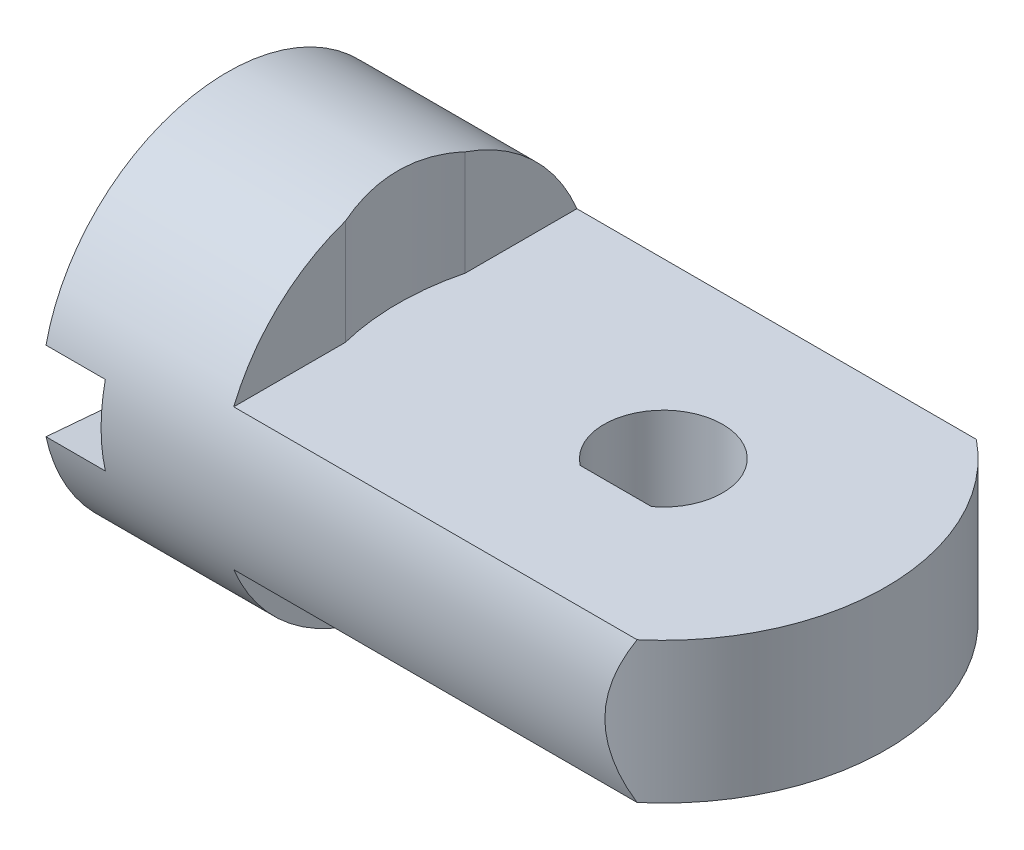
from build123d import *

# Parameters (mm, degrees)
SKETCH_1_W                = 50
SKETCH_1_H                = 40
EXTRUDE_1_DEPTH           = 8
CHAMFER_1_SIZE            = 10
SKETCH_2_R                = 1.55
CUT_EXTRUDE_1_DEPTH       = 10
EXTRUDE_2_DEPTH           = 50
EXTRUDE_2_DEPTH_BACK      = 15
SKETCH_3_R                = 12.5
SKETCH_4_R                = 1.7
CUT_EXTRUDE_2_DEPTH       = 15
CUT_EXTRUDE_START         = -20
CUT_EXTRUDE_3_DEPTH       = 20
SKETCH_7_R                = 16.5
CUT_EXTRUDE_8_DEPTH       = 33
CUT_EXTRUDE_9_DEPTH       = 20
CHAMFER_3_SIZE            = 2
SKETCH_10_OUTSIDE_W       = 49.114
SKETCH_10_OUTSIDE_H       = 64.114
SKETCH_10_OUTSIDE_R       = 12.5
CUT_EXTRUDE_10_DEPTH      = 10
CHAMFER_4_SIZE            = 10
SKETCH_12_W               = 1.5
SKETCH_12_H               = 20
SKETCH_14_W               = 12
SKETCH_14_H               = 23
CUT_EXTRUDE_11_DEPTH      = 3
CUT_EXTRUDE_12_DEPTH      = 4.2
SKETCH_16_R               = 1.1
CUT_EXTRUDE_13_DEPTH      = 5
SKETCH_17_R               = 3.372674955
EXTRUDE_3_DEPTH           = 4
SKETCH_18_R               = 1.1
CUT_EXTRUDE_14_DEPTH      = 4
SKETCH_20_R               = 4
CUT_EXTRUDE_15_DEPTH      = 4
CUT_EXTRUDE_16_DEPTH      = 80.355214185
CUT_EXTRUDE_16_DEPTH_BACK = 80.355214185
SKETCH_21_W               = 47.755098741
SKETCH_21_H               = 76.122443719
SKETCH_26_R               = 4
CUT_EXTRUDE_19_DEPTH      = 20
SKETCH_28_W               = 34.99561618
SKETCH_28_H               = 41.128829021
CUT_EXTRUDE_20_DEPTH      = 10
SKETCH_29_W               = 7.599941767
SKETCH_29_H               = 6.479768366
EXTRUDE_6_DEPTH           = 9.5
SKETCH_24_R               = 12.607397707
CUT_EXTRUDE_21_DEPTH      = 15
CUT_EXTRUDE_22_DEPTH      = 4


# Read off the part's stored shape, not the designer's step: 切除-拉伸3
with BuildPart() as part:
    # 草图1 → 凸台-拉伸1 (new body)
    with BuildSketch(Plane.XY):
        Rectangle(SKETCH_1_W, SKETCH_1_H)
    extrude(amount=EXTRUDE_1_DEPTH)

    # 倒角1
    chamfer_1_edges = [part.edges().sort_by_distance(p)[0] for p in [
        (-25, -20, 4),
        (-25, 20, 4),
    ]]
    chamfer(chamfer_1_edges, length=CHAMFER_1_SIZE)

    # 草图2 → 切除-拉伸1 (cut)
    with BuildSketch(Plane.XY.offset(8)):
        with Locations((-2, -10)):
            Circle(SKETCH_2_R)
        with Locations((-2, 10)):
            Circle(SKETCH_2_R)
    extrude(amount=-CUT_EXTRUDE_1_DEPTH, mode=Mode.SUBTRACT)

    # 草图3 → 凸台-拉伸2 (add, two sides: drawn at the far end of the back side and taken through both)
    with BuildSketch(Plane(origin=(25, 0, 0), x_dir=(0, 0, -1), z_dir=(1, 0, 0)).offset(-EXTRUDE_2_DEPTH_BACK)):
        with Locations(Location((-4, 0, 0), (0, 0, 251.337075115))):
            Circle(SKETCH_3_R)
    extrude(amount=EXTRUDE_2_DEPTH + EXTRUDE_2_DEPTH_BACK)

    # 草图4 → 切除-拉伸2 (cut)
    with BuildSketch(Plane.XY.offset(8)):
        with Locations((-19.690178066, -4)):
            Circle(SKETCH_4_R)
        with Locations((-19.690178066, 4)):
            Circle(SKETCH_4_R)
    extrude(amount=-CUT_EXTRUDE_2_DEPTH, mode=Mode.SUBTRACT)

    # 切除-拉伸3 outline → 切除-拉伸3 (cut)
    with BuildSketch(Plane(origin=(75, 0, 0), x_dir=(0, 0, -1), z_dir=(1, 0, 0)).offset(CUT_EXTRUDE_START)):
        with BuildLine():
            Line((7.56233108, -4.75), (-15.56233108, -4.75))
            ThreePointArc((-15.56233108, -4.75), (-4, -12.5), (7.56233108, -4.75))
        make_face()
        with BuildLine():
            ThreePointArc((7.56233108, 4.75), (-4, 12.5), (-15.56233108, 4.75))
            Line((-15.56233108, 4.75), (7.56233108, 4.75))
        make_face()
    extrude(amount=CUT_EXTRUDE_3_DEPTH, mode=Mode.SUBTRACT)

    # 草图7 → 切除-拉伸8 (cut)
    with BuildSketch(Plane.XZ.offset(4.75)):
        with Locations((58.5, 4)):
            Circle(SKETCH_7_R)
    cut_extrude_8 = extrude(amount=CUT_EXTRUDE_8_DEPTH, mode=Mode.SUBTRACT)

    # 镜向1: 切除-拉伸8 across plane
    add(cut_extrude_8.mirror(Plane.ZX), mode=Mode.SUBTRACT)

    # 草图8 → 切除-拉伸9 (cut)
    with BuildSketch(Plane.XZ.offset(4.75)):
        with BuildLine():
            Line((60, 19.107397707), (75.764252489, 33.62580965))
            Line((75.764252489, 33.62580965), (78.826270749, -18.347337912))
            Line((78.826270749, -18.347337912), (60, -10.892602293))
            ThreePointArc((60, -10.892602293), (75, 4.107397707), (60, 19.107397707))
        make_face()
    extrude(amount=-CUT_EXTRUDE_9_DEPTH, mode=Mode.SUBTRACT)

    # 倒角3
    chamfer_3_edges = [part.edges().sort_by_distance(p)[0] for p in [
        (10, 0, 16.5),
        (10, 0, -8.5),
    ]]
    chamfer(chamfer_3_edges, length=CHAMFER_3_SIZE)

    # 草图10 outside → 切除-拉伸10 (cut)
    with BuildSketch(Plane(origin=(25, 0, 0), x_dir=(0, 0, -1), z_dir=(1, 0, 0))):
        with Locations((-4, 0)):
            Rectangle(SKETCH_10_OUTSIDE_W, SKETCH_10_OUTSIDE_H)
        with Locations((-4.107397707, 0)):
            Circle(SKETCH_10_OUTSIDE_R, mode=Mode.SUBTRACT)
    extrude(amount=-CUT_EXTRUDE_10_DEPTH, mode=Mode.SUBTRACT)

    # 倒角4
    # the kernel refuses this chamfer: 10 mm, written as the material it takes off along each edge
    with BuildSketch(Plane(origin=(15, -20, -25.71682988), x_dir=(-0.9996219169112968, -0.027495876610586317, 0), z_dir=(0, 0, 1))) as chamfer_4_piece_1_section:
        Polygon((CHAMFER_4_SIZE * 0.999621916911, -CHAMFER_4_SIZE * 0.0274958766106), (-CHAMFER_4_SIZE * 0.0274958766106, -CHAMFER_4_SIZE * 0.999621916911), (0, 0), align=None)
    chamfer_4_piece_1 = extrude(amount=59.433659759, mode=Mode.PRIVATE)
    chamfer_4_piece_1 = chamfer_4_piece_1 - Plane(origin=(11.669205873, 0, 4.107397707), x_dir=(0, 0, -1), z_dir=(1, 0, 0)) * Cylinder(12.5, 159, mode=Mode.PRIVATE)
    add(chamfer_4_piece_1, mode=Mode.SUBTRACT)
    with BuildSketch(Plane(origin=(15, 20, 33.71682988), x_dir=(-0.9996219169112968, 0.027495876610586317, 0), z_dir=(0, 0, -1))) as chamfer_4_piece_2_section:
        Polygon((CHAMFER_4_SIZE * 0.999621916911, -CHAMFER_4_SIZE * 0.0274958766106), (-CHAMFER_4_SIZE * 0.0274958766106, -CHAMFER_4_SIZE * 0.999621916911), (0, 0), align=None)
    chamfer_4_piece_2 = extrude(amount=59.433659759, mode=Mode.PRIVATE)
    chamfer_4_piece_2 = chamfer_4_piece_2 - Plane(origin=(11.669205873, 0, 4.107397707), x_dir=(0, 0, -1), z_dir=(1, 0, 0)) * Cylinder(12.5, 159, mode=Mode.PRIVATE)
    add(chamfer_4_piece_2, mode=Mode.SUBTRACT)

    # 草图12 → 切除-旋转2 (revolve, cut)
    with BuildSketch(Plane(origin=(0, 0, 0), x_dir=(1, 0, 0), z_dir=(0, 1, 0))):
        with Locations((14.75, 8.392602293)):
            Rectangle(SKETCH_12_W, SKETCH_12_H)
    revolve(axis=Axis((50, 0, 4.107397707), (-1, 0, 0)), mode=Mode.SUBTRACT)

    # 草图14 → 切除-拉伸11 (cut)
    with BuildSketch(Plane(origin=(0, 0, 0), x_dir=(-1, 0, 0), z_dir=(0, 0, -1))):
        with Locations((2, 4.65)):
            Rectangle(SKETCH_14_W, SKETCH_14_H)
    extrude(amount=-CUT_EXTRUDE_11_DEPTH, mode=Mode.SUBTRACT)

    # 草图15 → 切除-拉伸12 (cut)
    with BuildSketch(Plane(origin=(0, 0, 3), x_dir=(-1, 0, 0), z_dir=(0, 0, -1))):
        with BuildLine():
            ThreePointArc((4.631967524, 4.49702381), (2, 16.1), (-0.631967524, 4.49702381))
            ThreePointArc((-0.631967524, 4.49702381), (2, 0.95), (4.631967524, 4.49702381))
        make_face()
    extrude(amount=-CUT_EXTRUDE_12_DEPTH, mode=Mode.SUBTRACT)

    # 草图16 → 切除-拉伸13 (cut)
    with BuildSketch(Plane(origin=(0, 0, 0), x_dir=(-1, 0, 0), z_dir=(0, 0, -1))):
        with Locations((2, 18.3)):
            Circle(SKETCH_16_R)
    extrude(amount=-CUT_EXTRUDE_13_DEPTH, mode=Mode.SUBTRACT)

    # 草图17 → 凸台-拉伸3 (add)
    with BuildSketch(Plane(origin=(0, 0, 0), x_dir=(-1, 0, 0), z_dir=(0, 0, -1))):
        with Locations((2, -10)):
            Circle(SKETCH_17_R)
    extrude(amount=-EXTRUDE_3_DEPTH)

    # 草图18 → 切除-拉伸14 (cut)
    with BuildSketch(Plane(origin=(0, 0, 0), x_dir=(-1, 0, 0), z_dir=(0, 0, -1))):
        with Locations((2, -9)):
            Circle(SKETCH_18_R)
    extrude(amount=-CUT_EXTRUDE_14_DEPTH, mode=Mode.SUBTRACT)

    # 草图20 → 切除-拉伸15 (cut)
    with BuildSketch(Plane(origin=(0, 0, 7.2), x_dir=(-1, 0, 0), z_dir=(0, 0, -1))):
        with Locations((2, 10)):
            Circle(SKETCH_20_R)
    extrude(amount=-CUT_EXTRUDE_15_DEPTH, mode=Mode.SUBTRACT)

    # 草图21 → 切除-拉伸16 (cut, two sides: drawn at the far end of the back side and taken through both)
    with BuildSketch(Plane(origin=(0, 0, 0), x_dir=(-1, 0, 0), z_dir=(0, 0, -1)).offset(-CUT_EXTRUDE_16_DEPTH_BACK)):
        with Locations((8.377549371, -2.117346793)):
            Rectangle(SKETCH_21_W, SKETCH_21_H)
    extrude(amount=CUT_EXTRUDE_16_DEPTH + CUT_EXTRUDE_16_DEPTH_BACK, mode=Mode.SUBTRACT)

    # 草图26 → 切除-拉伸19 (cut)
    with BuildSketch(Plane.XZ.offset(4.75)):
        with Locations((60, 4.107397707)):
            Circle(SKETCH_26_R)
    extrude(amount=-CUT_EXTRUDE_19_DEPTH, mode=Mode.SUBTRACT)

    # 草图28 → 切除-拉伸20 (cut)
    with BuildSketch(Plane.XZ.offset(4.75)):
        with Locations((60, 4.107397707)):
            Rectangle(SKETCH_28_W, SKETCH_28_H)
    cut_extrude_20 = extrude(amount=CUT_EXTRUDE_20_DEPTH, mode=Mode.SUBTRACT)

    # 镜向2: 切除-拉伸20 across plane
    add(cut_extrude_20.mirror(Plane.ZX), mode=Mode.SUBTRACT)

    # 草图29 → 凸台-拉伸6 (add)
    with BuildSketch(Plane.XZ.offset(4.75)):
        with Locations((61.399970884, 10.54728189)):
            Rectangle(SKETCH_29_W, SKETCH_29_H)
    extrude(amount=-EXTRUDE_6_DEPTH)

    # 草图24 → 切除-拉伸21 (cut)
    with BuildSketch(Plane.ZY.offset(-15.5)):
        with Locations((4.107397707, 0)):
            Circle(SKETCH_24_R)
    extrude(amount=-CUT_EXTRUDE_21_DEPTH, mode=Mode.SUBTRACT)

    # 草图30 → 切除-拉伸22 (cut)
    with BuildSketch(Plane.ZY.offset(-30.5)):
        with BuildLine():
            Line((6.307397707, -6.9), (6.307397707, 6.9))
            ThreePointArc((6.307397707, 6.9), (4.107397707, 9.1), (1.907397707, 6.9))
            Line((1.907397707, 6.9), (1.907397707, -6.9))
            ThreePointArc((1.907397707, -6.9), (4.107397707, -9.1), (6.307397707, -6.9))
        make_face()
        with BuildLine():
            Line((-8.058924565, -3.29125179), (1.907397707, -4))
            Line((1.907397707, -4), (1.907397707, 4))
            Line((1.907397707, 4), (-8.058924565, 3.29125179))
            ThreePointArc((-8.058924565, 3.29125179), (-8.5, 0), (-8.058924565, -3.29125179))
        make_face()
        with BuildLine():
            Line((6.307397707, 3.5), (6.307397707, -3.5))
            Line((6.307397707, -3.5), (16.211202868, -2.671427431))
            ThreePointArc((16.211202868, -2.671427431), (16.427590994, -1.343496214), (16.5, 0))
            ThreePointArc((16.5, 0), (16.427590994, 1.343496214), (16.211202868, 2.671427431))
            Line((16.211202868, 2.671427431), (6.307397707, 3.5))
        make_face()
    extrude(amount=-CUT_EXTRUDE_22_DEPTH, mode=Mode.SUBTRACT)


solid = part.part
